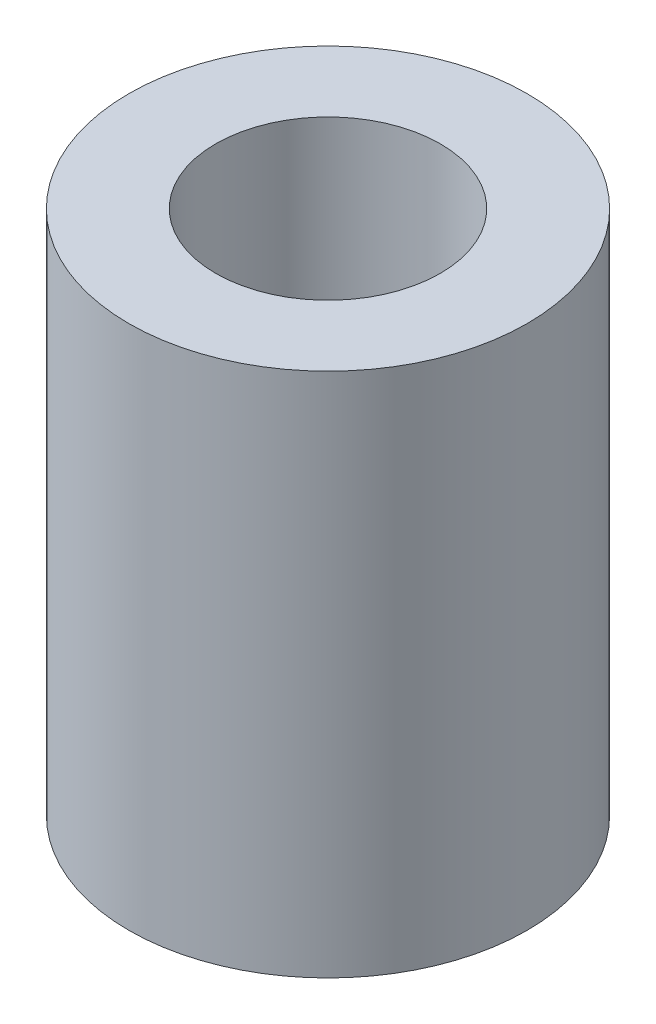
from build123d import *

# Parameters (mm, degrees)
SKETCH1_R           = 5
BOSS_EXTRUDE1_DEPTH = 13.193846081
SKETCH2_R           = 2.819068876
CUT_EXTRUDE1_DEPTH  = 15.969220902


with BuildPart() as part:
    # Sketch1 → Boss-Extrude1 (new body)
    with BuildSketch(Plane(origin=(0, 0, 0), x_dir=(1, 0, 0), z_dir=(0, 1, 0))):
        Circle(SKETCH1_R)
    extrude(amount=BOSS_EXTRUDE1_DEPTH)

    # Sketch2 → Cut-Extrude1 (cut, through all)
    with BuildSketch(Plane(origin=(0, 0, 0), x_dir=(1, 0, 0), z_dir=(0, 1, 0))):
        Circle(SKETCH2_R)
    extrude(amount=CUT_EXTRUDE1_DEPTH, mode=Mode.SUBTRACT)


solid = part.part
